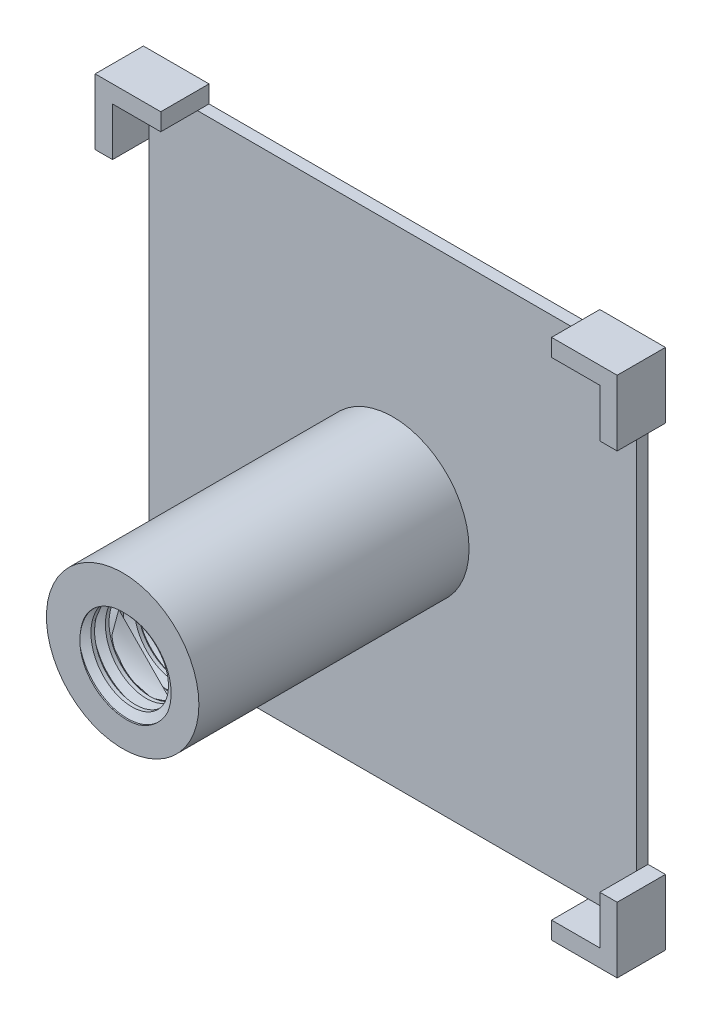
from build123d import *

# Parameters (mm, degrees)
CROQUIS1_W              = 50.5
CROQUIS1_H              = 50.5
CROQUIS1_R              = 5.2
SALIENTE_EXTRUIR1_DEPTH = 1.2
CROQUIS2_R              = 7.9
CROQUIS2_R_2            = 5.2
SALIENTE_EXTRUIR2_DEPTH = 28
ROSCA1_PITCH            = 1.5
SALIENTE_EXTRUIR3_DEPTH = 5
CROQUIS4_R              = 7.7
CORTAR_EXTRUIR1_DEPTH   = 10
CORTAR_EXTRUIR2_START   = -29.2
CROQUIS4_2_R            = 7.7
CORTAR_EXTRUIR2_DEPTH   = 10


with BuildPart() as part:
    # Croquis1 → Saliente-Extruir1 (new body)
    with BuildSketch(Plane.XY):
        Rectangle(CROQUIS1_W, CROQUIS1_H)
        Circle(CROQUIS1_R, mode=Mode.SUBTRACT)
    extrude(amount=SALIENTE_EXTRUIR1_DEPTH)

    # Croquis2 → Saliente-Extruir2 (add)
    with BuildSketch(Plane.XY.offset(1.2)):
        Circle(CROQUIS2_R)
        Circle(CROQUIS2_R_2, mode=Mode.SUBTRACT)
    extrude(amount=SALIENTE_EXTRUIR2_DEPTH)

    # Rosca1: arcs per turn and ends read off the stored shape
    # Rosca1: the profile of Perfil de rosca1 profile screwed along a right-hand helix through 21.466667 turns, 8 arcs to a turn; built about Z, then put on its axis
    rosca1_z = Axis((0, 0, 0), (0, 0, 1))
    rosca1_corners = [(5.2003, 0, -0.000173205), (5.2003, 0, 1.312673201), (4.388101188, 0, 0.843749998), (4.388101188, 0, 0.468749998)]
    with BuildLine(mode=Mode.PRIVATE) as rosca1_profile:
        Line(rosca1_corners[0], rosca1_corners[1])
        Line(rosca1_corners[1], rosca1_corners[2])
        Line(rosca1_corners[2], rosca1_corners[3])
        Line(rosca1_corners[3], rosca1_corners[0])
    rosca1_cap = Face(rosca1_profile.wire())
    rosca1_turn_angles = [0, 22.5, 45, 67.5, 90, 112.5, 135, 157.5, 180, 202.5, 225, 247.5, 270, 292.5, 315, 337.5, 360]
    rosca1_turn_weights = [1, 0.9238795325112867, 1, 0.9238795325112867, 1, 0.9238795325112867, 1, 0.9238795325112867, 1, 0.9238795325112867, 1, 0.9238795325112867, 1, 0.9238795325112867, 1, 0.9238795325112867, 1]
    rosca1_turn_rails = [Edge.make_bspline([Vector(p[0], p[1], 0).rotate(rosca1_z, rosca1_turn_angles[k]) / rosca1_turn_weights[k] + Vector(0, 0, p[2] + ROSCA1_PITCH * rosca1_turn_angles[k] / 360) for k in range(17)], [0, 0, 0, 1, 1, 2, 2, 3, 3, 4, 4, 5, 5, 6, 6, 7, 7, 8, 8, 8], 2, rosca1_turn_weights) for p in rosca1_corners]
    rosca1_turn_sides = [Face.make_surface_from_curves(rosca1_turn_rails[p[0]], rosca1_turn_rails[p[1]]) for p in [(0, 1), (1, 2), (2, 3), (3, 0)]]
    rosca1_last_angles = [7560, 7582.5, 7605, 7627.5, 7650, 7672.5, 7695, 7711.5, 7728]
    rosca1_last_weights = [1, 0.9238795325112867, 1, 0.9238795325112867, 1, 0.9238795325112867, 1, 0.958819734868193, 1]
    rosca1_last_rails = [Edge.make_bspline([Vector(p[0], p[1], 0).rotate(rosca1_z, rosca1_last_angles[k]) / rosca1_last_weights[k] + Vector(0, 0, p[2] + ROSCA1_PITCH * rosca1_last_angles[k] / 360) for k in range(9)], [0, 0, 0, 1, 1, 2, 2, 3, 3, 4, 4, 4], 2, rosca1_last_weights) for p in rosca1_corners]
    rosca1_last_sides = [Face.make_surface_from_curves(rosca1_last_rails[p[0]], rosca1_last_rails[p[1]]) for p in [(0, 1), (1, 2), (2, 3), (3, 0)]]
    rosca1 = Plane(origin=(0, 0, -2), x_dir=(1, 0, 0), z_dir=(0, 0, 1)) * Solid(Shell([*[p.moved(Location((0, 0, ROSCA1_PITCH * i))) for i in range(21) for p in rosca1_turn_sides], *rosca1_last_sides, rosca1_cap, rosca1_cap.rotate(rosca1_z, 7728).moved(Location((0, 0, ROSCA1_PITCH * 7728 / 360)))]))
    add(rosca1)

    # Croquis3 → Saliente-Extruir3 (add)
    with BuildSketch(Plane(origin=(0, 0, 0), x_dir=(-1, 0, 0), z_dir=(0, 0, -1))):
        Polygon((25.25, -25.25), (25.25, -20.25), (27.05, -20.25), (27.05, -27.05), (20.25, -27.05), (20.25, -25.25), align=None)
        Polygon((-25.25, -25.25), (-20.25, -25.25), (-20.25, -27.05), (-27.05, -27.05), (-27.05, -20.25), (-25.25, -20.25), align=None)
        Polygon((-25.25, 25.25), (-25.25, 20.25), (-27.05, 20.25), (-27.05, 27.05), (-20.25, 27.05), (-20.25, 25.25), align=None)
        Polygon((25.25, 25.25), (20.25, 25.25), (20.25, 27.05), (27.05, 27.05), (27.05, 20.25), (25.25, 20.25), align=None)
    extrude(amount=-SALIENTE_EXTRUIR3_DEPTH)

    # Croquis4 → Cortar-Extruir1 (cut)
    with BuildSketch(Plane.XY.offset(29.2)):
        Circle(CROQUIS4_R)
    extrude(amount=CORTAR_EXTRUIR1_DEPTH, mode=Mode.SUBTRACT)

    # Croquis4<2> → Cortar-Extruir2 (cut)
    with BuildSketch(Plane.XY.offset(29.2).offset(CORTAR_EXTRUIR2_START)):
        Circle(CROQUIS4_2_R)
    extrude(amount=-CORTAR_EXTRUIR2_DEPTH, mode=Mode.SUBTRACT)


solid = part.part
